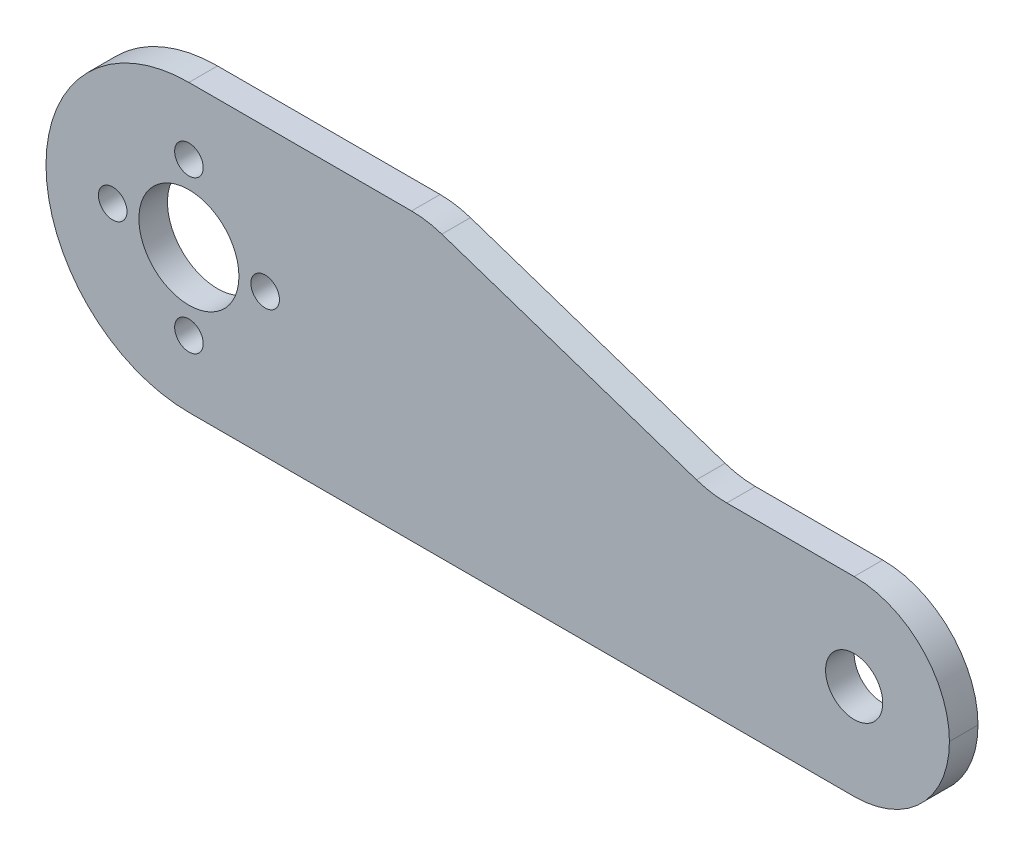
from build123d import *

# Parameters (mm, degrees)
SKETCH_1_R      = 5.25
SKETCH_1_R_2    = 1.5
SKETCH_1_R_3    = 3
EXTRUDE_1_DEPTH = 3
FILLET_1_R      = 10
FILLET_2_R      = 15


with BuildPart() as part:
    # 草图1 → 凸台-拉伸1 (new body)
    with BuildSketch(Plane.XY):
        Polygon((94.821200219, 20), (69.821200219, 20), (40, 30), (0, 30), (0, 0), (94.821200219, 0), align=None)
        with Locations((15, 15)):
            Circle(SKETCH_1_R, mode=Mode.SUBTRACT)
        with Locations((15, 23)):
            Circle(SKETCH_1_R_2, mode=Mode.SUBTRACT)
        with Locations((15, 7)):
            Circle(SKETCH_1_R_2, mode=Mode.SUBTRACT)
        with Locations((23, 15)):
            Circle(SKETCH_1_R_2, mode=Mode.SUBTRACT)
        with Locations((7, 15)):
            Circle(SKETCH_1_R_2, mode=Mode.SUBTRACT)
        with Locations((84.821200219, 10)):
            Circle(SKETCH_1_R_3, mode=Mode.SUBTRACT)
    extrude(amount=EXTRUDE_1_DEPTH)

    # 圆角1
    fillet_1_edges = [part.edges().sort_by_distance(p)[0] for p in [
        (94.821200219, 0, 1.5),
        (94.821200219, 20, 1.5),
        (69.821200219, 20, 1.5),
        (40, 30, 1.5),
    ]]
    fillet(fillet_1_edges, radius=FILLET_1_R - 0.0001)  # a hair under: the kernel refuses the full size

    # 圆角2
    fillet_2_edges = [part.edges().sort_by_distance(p)[0] for p in [
        (0, 0, 1.5),
        (0, 30, 1.5),
    ]]
    fillet(fillet_2_edges, radius=FILLET_2_R - 0.0001)  # a hair under: the kernel refuses the full size


solid = part.part
